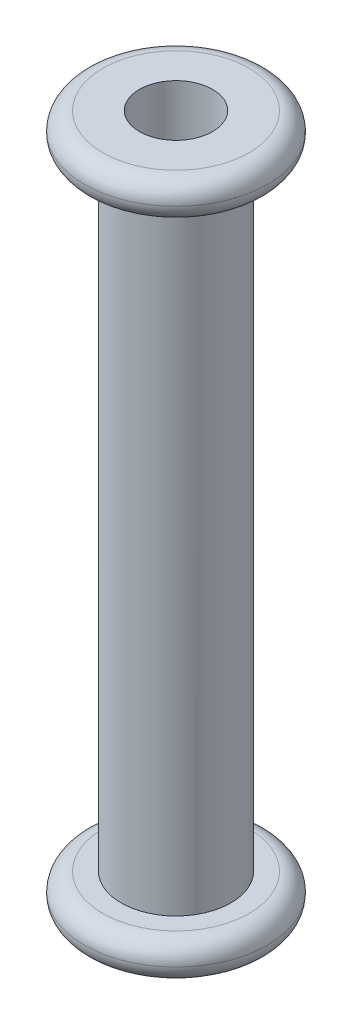
from build123d import *

# Parameters (mm, degrees)
SKETCH1_R           = 3
SKETCH1_R_2         = 2
BOSS_EXTRUDE1_DEPTH = 38
SKETCH2_R           = 5
SKETCH2_R_2         = 3
BOSS_EXTRUDE2_DEPTH = 2
BOSS_EXTRUDE3_START = -2
SKETCH3_R           = 5
SKETCH3_R_2         = 3
BOSS_EXTRUDE3_DEPTH = 2
FILLET4_R           = 1
FILLET5_R           = 1
FILLET6_R           = 1


with BuildPart() as part:
    # Sketch1 → Boss-Extrude1 (new body)
    with BuildSketch(Plane(origin=(0, 0, 0), x_dir=(1, 0, 0), z_dir=(0, 1, 0))):
        with Locations(Location((0, 0, 0), (0, 0, 270))):
            Circle(SKETCH1_R)
        with Locations(Location((0, 0, 0), (0, 0, 270))):
            Circle(SKETCH1_R_2, mode=Mode.SUBTRACT)
    extrude(amount=BOSS_EXTRUDE1_DEPTH)

    # Sketch2 → Boss-Extrude2 (add)
    with BuildSketch(Plane.XZ):
        with Locations(Location((0, 0, 0), (0, 0, 270))):
            Circle(SKETCH2_R)
        with Locations(Location((0, 0, 0), (0, 0, 270))):
            Circle(SKETCH2_R_2, mode=Mode.SUBTRACT)
    extrude(amount=-BOSS_EXTRUDE2_DEPTH)

    # Sketch3 → Boss-Extrude3 (add)
    with BuildSketch(Plane(origin=(0, 38, 0), x_dir=(1, 0, 0), z_dir=(0, 1, 0)).offset(BOSS_EXTRUDE3_START)):
        with Locations(Location((0, 0, 0), (0, 0, 90))):
            Circle(SKETCH3_R)
        with Locations(Location((0, 0, 0), (0, 0, 90))):
            Circle(SKETCH3_R_2, mode=Mode.SUBTRACT)
    extrude(amount=BOSS_EXTRUDE3_DEPTH)

    # Fillet4
    fillet4_edges = [part.edges().sort_by_distance(p)[0] for p in [
        (0, 0, 5),
    ]]
    fillet(fillet4_edges, radius=FILLET4_R)

    # Fillet5
    fillet5_edges = [part.edges().sort_by_distance(p)[0] for p in [
        (0, 2, 5),
    ]]
    fillet(fillet5_edges, radius=FILLET5_R - 0.0001)  # a hair under: the kernel refuses the full size

    # Fillet6
    fillet6_edges = [part.edges().sort_by_distance(p)[0] for p in [
        (0, 36, 5),
        (0, 38, 5),
    ]]
    fillet(fillet6_edges, radius=FILLET6_R - 0.0001)  # a hair under: the kernel refuses the full size


solid = part.part
